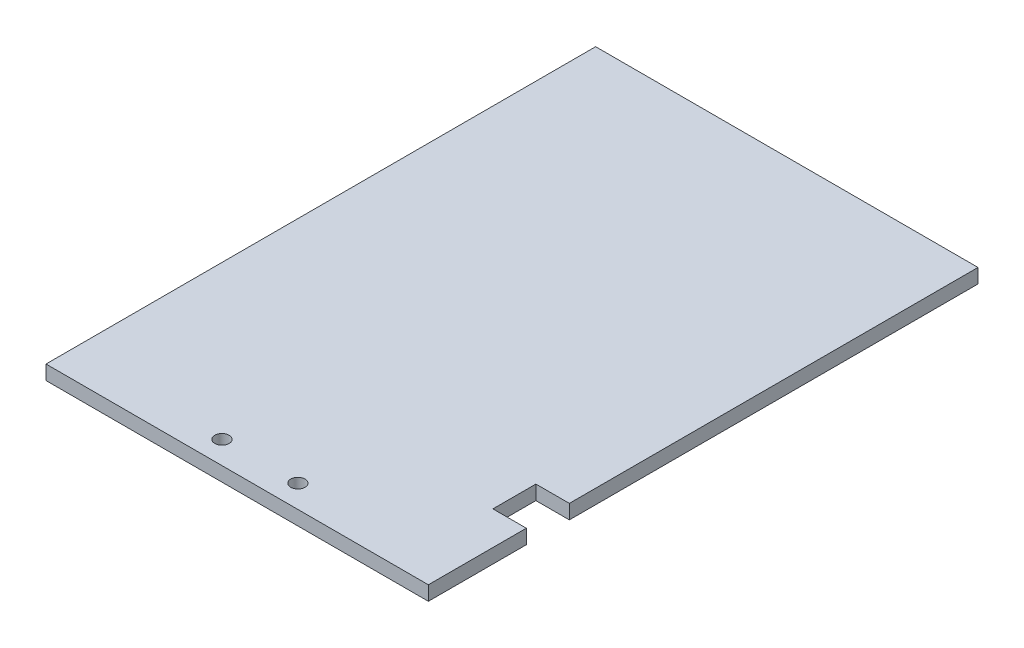
from build123d import *

# Parameters (mm, degrees)
SKETCH1_W             = 80
SKETCH1_H             = 105
BOSS_EXTRUDE1_DEPTH   = 3
SKETCH4_W             = 80
SKETCH4_H             = 3
BOSS_EXTRUDE3_DEPTH   = 10
SKETCH9_W             = 7
SKETCH9_H             = 9
CUT_EXTRUDE1_DEPTH    = 10
CROQUIS1_R            = 1.5
CORTAR_EXTRUIR1_DEPTH = 10


with BuildPart() as part:
    # Sketch1 → Boss-Extrude1 (new body)
    with BuildSketch(Plane(origin=(0, 0, 0), x_dir=(1, 0, 0), z_dir=(0, 1, 0))):
        with Locations((40, 52.5)):
            Rectangle(SKETCH1_W, SKETCH1_H)
    extrude(amount=BOSS_EXTRUDE1_DEPTH)

    # Sketch4 → Boss-Extrude3 (add)
    with BuildSketch(Plane.XY):
        with Locations((40, 1.5)):
            Rectangle(SKETCH4_W, SKETCH4_H)
    extrude(amount=BOSS_EXTRUDE3_DEPTH)

    # Sketch9 → Cut-Extrude1 (cut)
    with BuildSketch(Plane(origin=(0, 3, 0), x_dir=(1, 0, 0), z_dir=(0, 1, 0))):
        with Locations((76.5, 15)):
            Rectangle(SKETCH9_W, SKETCH9_H)
    extrude(amount=-CUT_EXTRUDE1_DEPTH, mode=Mode.SUBTRACT)

    # Croquis1 → Cortar-Extruir1 (cut)
    with BuildSketch(Plane(origin=(0, 3, 0), x_dir=(1, 0, 0), z_dir=(0, 1, 0))):
        with Locations((32.06, -5.24)):
            Circle(CROQUIS1_R)
        with Locations((47.94, -5.24)):
            Circle(CROQUIS1_R)
    extrude(amount=-CORTAR_EXTRUIR1_DEPTH, mode=Mode.SUBTRACT)


solid = part.part
